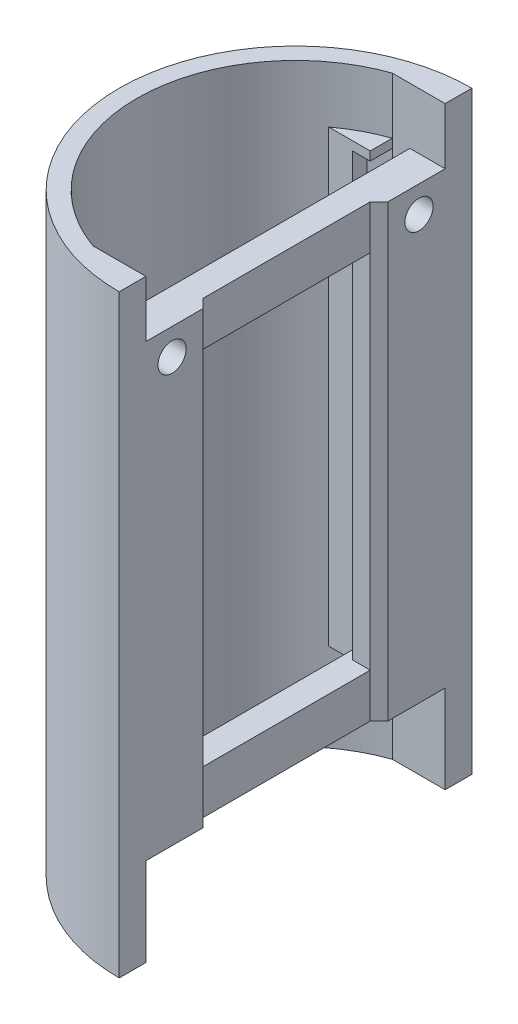
from build123d import *
from build123d.topology import SkipClean

# Parameters (mm, degrees)
EXTRUDE_1_DEPTH           = 70
SKETCH_3_R                = 1
CUT_EXTRUDE_2_DEPTH       = 4
CUT_EXTRUDE_START         = 70
SKETCH_5_W                = 4
SKETCH_5_H                = 33.941125496
CUT_EXTRUDE_4_DEPTH       = 9
EXTRUDE_2_DEPTH           = 70
SKETCH_7_W                = 4
SKETCH_7_H                = 33.941125496
CUT_EXTRUDE_5_DEPTH       = 10
EXTRUDE_START             = 61
SKETCH_8_W                = 6
SKETCH_8_H                = 2.5
EXTRUDE_3_DEPTH           = 1
EXTRUDE_4_DEPTH           = 70
SKETCH_11_W               = 6
SKETCH_11_H               = 2.5
EXTRUDE_5_DEPTH           = 9
CUT_EXTRUDE_START_2       = 16.970563
SKETCH_12_W               = 2
SKETCH_12_H               = 1
CUT_EXTRUDE_6_DEPTH       = 33.941125497
CUT_EXTRUDE_START_3       = 10
SKETCH_14_W               = 1
SKETCH_14_H               = 20.941125496
CUT_EXTRUDE_8_DEPTH       = 51
CUT_EXTRUDE_START_4       = -1
SKETCH_15_W               = 18.941125496
SKETCH_15_H               = 41
CUT_EXTRUDE_9_DEPTH       = 2
SKETCH_17_R               = 1.6
CUT_EXTRUDE_10_DEPTH      = 2.5
EXTRUDE_11_DEPTH          = 51
EXTRUDE_12_DEPTH          = 5
EXTRUDE_START_2           = 10
EXTRUDE_13_DEPTH          = 5
CUT_EXTRUDE_START_5       = 55
CUT_EXTRUDE_11_DEPTH      = 6
CUT_EXTRUDE_12_REACH      = 77.498
CUT_EXTRUDE_12_END_RADIUS = 18
SKETCH_24_W               = 2
SKETCH_24_H               = 6
CUT_EXTRUDE_13_DEPTH      = 10
CUT_EXTRUDE_START_6       = 61
CUT_EXTRUDE_18_DEPTH      = 9
EXTRUDE_START_3           = 60
EXTRUDE_16_DEPTH          = 1
EXTRUDE_START_4           = 70
EXTRUDE_17_DEPTH          = 2.4
CUT_EXTRUDE_START_7       = 67.4
CUT_EXTRUDE_19_DEPTH      = 5
SKETCH_33_W               = 2
SKETCH_33_H               = 33.941125496
CUT_EXTRUDE_20_DEPTH      = 61


# Read off the part's stored shape, not the designer's step: 切除-拉伸11
with BuildPart() as part:
    # 草图1 → 凸台-拉伸1 (new body)
    with BuildSketch(Plane(origin=(0, 0, 0), x_dir=(1, 0, 0), z_dir=(0, 1, 0))):
        with BuildLine():
            Line((0, 20), (0, -20))
            ThreePointArc((0, -20), (-20, 0), (0, 20))
        make_face()
        with BuildLine():
            Line((-4, -17.549928775), (-4, 17.549928775))
            ThreePointArc((-4, 17.549928775), (-18, 0), (-4, -17.549928775))
        make_face(mode=Mode.SUBTRACT)
    extrude(amount=EXTRUDE_1_DEPTH)

    # 草图3 → 切除-拉伸2 (cut)
    with BuildSketch(Plane(origin=(0, 0, 0), x_dir=(0, 0, -1), z_dir=(1, 0, 0))):
        with Locations(Location((-14, 58, 0), (0, 0, 180))):
            Circle(SKETCH_3_R)
        with Locations(Location((14, 58, 0), (0, 0, 180))):
            Circle(SKETCH_3_R)
    extrude(amount=-CUT_EXTRUDE_2_DEPTH, mode=Mode.SUBTRACT)

    # 草图5 → 切除-拉伸4 (cut)
    with BuildSketch(Plane(origin=(0, 0, 0), x_dir=(1, 0, 0), z_dir=(0, 1, 0)).offset(CUT_EXTRUDE_START)):
        with Locations((-2, 0)):
            Rectangle(SKETCH_5_W, SKETCH_5_H)
    extrude(amount=-CUT_EXTRUDE_4_DEPTH, mode=Mode.SUBTRACT)

    # 草图6 → 凸台-拉伸2 (add)
    with BuildSketch(Plane(origin=(0, 0, 0), x_dir=(1, 0, 0), z_dir=(0, 1, 0))):
        with BuildLine():
            Line((-4, 16.970562748), (-6, 16.970562748))
            ThreePointArc((-6, 16.970562748), (-3.043835617, 17.740774074), (0, 18))
            Line((0, 18), (0, 16.970562748))
            Line((0, 16.970562748), (-4, 16.970562748))
        make_face()
        with BuildLine():
            Line((-4, -16.970562748), (-6, -16.970562748))
            ThreePointArc((-6, -16.970562748), (-3.043835617, -17.740774074), (0, -18))
            Line((0, -18), (0, -16.970562748))
            Line((0, -16.970562748), (-4, -16.970562748))
        make_face()
    extrude(amount=EXTRUDE_2_DEPTH)

    # 草图7 → 切除-拉伸5 (cut)
    with BuildSketch(Plane(origin=(0, 0, 0), x_dir=(1, 0, 0), z_dir=(0, 1, 0))):
        with Locations((-2, 0)):
            Rectangle(SKETCH_7_W, SKETCH_7_H)
    extrude(amount=CUT_EXTRUDE_5_DEPTH, mode=Mode.SUBTRACT)

    # 草图8 → 凸台-拉伸3 (add)
    with BuildSketch(Plane(origin=(0, 0, 0), x_dir=(1, 0, 0), z_dir=(0, 1, 0)).offset(EXTRUDE_START)):
        with Locations((-3, 15.720562748)):
            Rectangle(SKETCH_8_W, SKETCH_8_H)
        with Locations((-3, -15.720562748)):
            Rectangle(SKETCH_8_W, SKETCH_8_H)
    extrude(amount=-EXTRUDE_3_DEPTH)

    # 草图10 → 凸台-拉伸4 (add)
    with BuildSketch(Plane(origin=(0, 0, 0), x_dir=(1, 0, 0), z_dir=(0, 1, 0))):
        with BuildLine():
            Line((-6, 16.970562748), (-6, 14.470562748))
            Line((-6, 14.470562748), (-10.705270372, 14.470562748))
            ThreePointArc((-10.705270372, 14.470562748), (-8.445650629, 15.895627872), (-6, 16.970562748))
        make_face()
        with BuildLine():
            Line((-6, -14.470562748), (-10.705270372, -14.470562748))
            ThreePointArc((-10.705270372, -14.470562748), (-8.445650629, -15.895627872), (-6, -16.970562748))
            Line((-6, -16.970562748), (-6, -14.470562748))
        make_face()
    extrude(amount=EXTRUDE_4_DEPTH)

    # 草图11 → 凸台-拉伸5 (add)
    with BuildSketch(Plane(origin=(0, 0, 0), x_dir=(1, 0, 0), z_dir=(0, 1, 0)).offset(EXTRUDE_START)):
        with Locations((-3, 15.720562748)):
            Rectangle(SKETCH_11_W, SKETCH_11_H)
        with Locations((-3, -15.720562748)):
            Rectangle(SKETCH_11_W, SKETCH_11_H)
    extrude(amount=EXTRUDE_5_DEPTH)

    # 草图12 → 切除-拉伸6 (cut)
    with SkipClean():  # the faces are left unmerged after this step: merging them gives an invalid solid
        with BuildSketch(Plane.XY.offset(CUT_EXTRUDE_START_2)):
            with Locations((-5, 60.5)):
                Rectangle(SKETCH_12_W, SKETCH_12_H)
        extrude(amount=-CUT_EXTRUDE_6_DEPTH, mode=Mode.SUBTRACT)

    # 草图14 → 切除-拉伸8 (cut)
    with SkipClean():  # the faces are left unmerged after this step: merging them gives an invalid solid
        with BuildSketch(Plane(origin=(0, 0, 0), x_dir=(1, 0, 0), z_dir=(0, 1, 0)).offset(CUT_EXTRUDE_START_3)):
            with Locations((-3.5, 0)):
                Rectangle(SKETCH_14_W, SKETCH_14_H)
            with Locations((-0.5, 0)):
                Rectangle(SKETCH_14_W, SKETCH_14_H)
        extrude(amount=CUT_EXTRUDE_8_DEPTH, mode=Mode.SUBTRACT)

    # 草图15 → 切除-拉伸9 (cut)
    with SkipClean():  # the faces are left unmerged after this step: merging them gives an invalid solid
        with BuildSketch(Plane(origin=(0, 0, 0), x_dir=(0, 0, -1), z_dir=(1, 0, 0)).offset(CUT_EXTRUDE_START_4)):
            with Locations((0, 35.5)):
                Rectangle(SKETCH_15_W, SKETCH_15_H)
        extrude(amount=-CUT_EXTRUDE_9_DEPTH, mode=Mode.SUBTRACT)

    # 草图17 → 切除-拉伸10 (cut)
    with SkipClean():  # the faces are left unmerged after this step: merging them gives an invalid solid
        with BuildSketch(Plane(origin=(0, 0, 0), x_dir=(0, 0, -1), z_dir=(1, 0, 0))):
            with Locations((-14, 58)):
                Circle(SKETCH_17_R)
            with Locations((14, 58)):
                Circle(SKETCH_17_R)
        extrude(amount=-CUT_EXTRUDE_10_DEPTH, mode=Mode.SUBTRACT)

    # 草图20 → 凸台-拉伸11 (add)
    with SkipClean():  # the faces are left unmerged after this step: merging them gives an invalid solid
        with BuildSketch(Plane(origin=(0, 0, 0), x_dir=(1, 0, 0), z_dir=(0, 1, 0)).offset(EXTRUDE_START)):
            Polygon((-1, 10.470562748), (0, 10.470562748), (-1, 9.470562748), align=None)
            Polygon((-4, 10.470562748), (-3, 10.470562748), (-3, 9.470562748), align=None)
            Polygon((-4, -10.470562748), (-3, -10.470562748), (-3, -9.470562748), align=None)
            Polygon((0, -10.470562748), (-1, -10.470562748), (-1, -9.470562748), align=None)
        extrude(amount=-EXTRUDE_11_DEPTH)

    # 草图21 → 凸台-拉伸12 (add)
    with SkipClean():  # the faces are left unmerged after this step: merging them gives an invalid solid
        with BuildSketch(Plane(origin=(0, 0, 0), x_dir=(1, 0, 0), z_dir=(0, 1, 0)).offset(EXTRUDE_START)):
            Polygon((-4, 10.470562748), (-4, -10.470562748), (-3, -9.470562748), (-3, 9.470562748), align=None)
        extrude(amount=-EXTRUDE_12_DEPTH)

    # 草图22 → 凸台-拉伸13 (add)
    with SkipClean():  # the faces are left unmerged after this step: merging them gives an invalid solid
        with BuildSketch(Plane(origin=(0, 0, 0), x_dir=(1, 0, 0), z_dir=(0, 1, 0)).offset(EXTRUDE_START_2)):
            Polygon((-4, 10.470562748), (-4, -10.470562748), (-3, -9.470562748), (-3, 9.470562748), align=None)
        extrude(amount=EXTRUDE_13_DEPTH)

    # 切除-拉伸11 outline → 切除-拉伸11 (cut)
    with SkipClean():  # the faces are left unmerged after this step: merging them gives an invalid solid
        with BuildSketch(Plane(origin=(0, 0, 0), x_dir=(1, 0, 0), z_dir=(0, 1, 0)).offset(CUT_EXTRUDE_START_5)):
            with BuildLine():
                ThreePointArc((-8, -16.124515497), (-7.012770422, -16.577727559), (-6, -16.970562748))
                Line((-6, -16.970562748), (-6, -14.470562748))
                Line((-6, -14.470562748), (-8, -14.470562748))
                Line((-8, -14.470562748), (-8, -16.124515497))
            make_face()
        extrude(amount=CUT_EXTRUDE_11_DEPTH, mode=Mode.SUBTRACT)

    # 切除-拉伸12: up to this cylinder (the profile starts inside it)
    with SkipClean():  # the faces are left unmerged after this step: merging them gives an invalid solid
        cut_extrude_12_end = Plane(origin=(0, 58, 0), z_dir=(0, -1, 0)) * Cylinder(CUT_EXTRUDE_12_END_RADIUS, 191.996, mode=Mode.PRIVATE)
        # 草图24 → 切除-拉伸12 (cut, up to the surface)
        with BuildSketch(Plane.XY, mode=Mode.PRIVATE) as cut_extrude_12_sk1:
            with Locations((-7, 58)):
                Rectangle(SKETCH_24_W, SKETCH_24_H)
        cut_extrude_12_tool1 = extrude(cut_extrude_12_sk1.sketch, amount=-CUT_EXTRUDE_12_REACH, mode=Mode.PRIVATE) & cut_extrude_12_end
        add(cut_extrude_12_tool1.solids().sort_by_distance((-7, 58, 0))[0], mode=Mode.SUBTRACT)

    # 草图25 → 切除-拉伸13 (cut)
    with SkipClean():  # the faces are left unmerged after this step: merging them gives an invalid solid
        with BuildSketch(Plane(origin=(0, 0, 0), x_dir=(1, 0, 0), z_dir=(0, 1, 0))):
            with BuildLine():
                Line((-6, -16.970562748), (-6, -14.470562748))
                Line((-6, -14.470562748), (-10.705270372, -14.470562748))
                ThreePointArc((-10.705270372, -14.470562748), (-8.445650629, -15.895627872), (-6, -16.970562748))
            make_face()
            with BuildLine():
                Line((-10.705270372, 14.470562748), (-6, 14.470562748))
                Line((-6, 14.470562748), (-6, 16.970562748))
                ThreePointArc((-6, 16.970562748), (-8.445650629, 15.895627872), (-10.705270372, 14.470562748))
            make_face()
        extrude(amount=CUT_EXTRUDE_13_DEPTH, mode=Mode.SUBTRACT)

    # 草图29 → 切除-拉伸18 (cut)
    with SkipClean():  # the faces are left unmerged after this step: merging them gives an invalid solid
        with BuildSketch(Plane(origin=(0, 0, 0), x_dir=(1, 0, 0), z_dir=(0, 1, 0)).offset(CUT_EXTRUDE_START_6)):
            with BuildLine():
                Line((0, -16.970562748), (0, -14.470562748))
                Line((0, -14.470562748), (-10.705270372, -14.470562748))
                ThreePointArc((-10.705270372, -14.470562748), (-8.445650629, -15.895627872), (-6, -16.970562748))
                Line((-6, -16.970562748), (0, -16.970562748))
            make_face()
            with BuildLine():
                Line((-6, 16.970562748), (0, 16.970562748))
                Line((0, 16.970562748), (0, 14.470562748))
                Line((0, 14.470562748), (-10.705270372, 14.470562748))
                ThreePointArc((-10.705270372, 14.470562748), (-8.445650629, 15.895627872), (-6, 16.970562748))
            make_face()
        extrude(amount=CUT_EXTRUDE_18_DEPTH, mode=Mode.SUBTRACT)

    # 草图30 → 凸台-拉伸16 (add)
    with BuildSketch(Plane(origin=(0, 0, 0), x_dir=(1, 0, 0), z_dir=(0, 1, 0)).offset(EXTRUDE_START_3)):
        with BuildLine():
            Line((-8, 16.124515497), (-8, 14.470562748))
            Line((-8, 14.470562748), (-4, 14.470562748))
            Line((-4, 14.470562748), (-4, 16.970562748))
            Line((-4, 16.970562748), (-6, 16.970562748))
            ThreePointArc((-6, 16.970562748), (-7.012770422, 16.577727559), (-8, 16.124515497))
        make_face()
        with BuildLine():
            Line((-8, -16.124515497), (-8, -14.470562748))
            Line((-8, -14.470562748), (-4, -14.470562748))
            Line((-4, -14.470562748), (-4, -16.970562748))
            Line((-4, -16.970562748), (-6, -16.970562748))
            ThreePointArc((-6, -16.970562748), (-7.012770422, -16.577727559), (-8, -16.124515497))
        make_face()
    extrude(amount=EXTRUDE_16_DEPTH)

    # 草图31 → 凸台-拉伸17 (add)
    with BuildSketch(Plane(origin=(0, 0, 0), x_dir=(1, 0, 0), z_dir=(0, 1, 0)).offset(EXTRUDE_START_4)):
        with BuildLine():
            Line((0, -20), (0, -16.970562748))
            Line((0, -16.970562748), (-6, -16.970562748))
            ThreePointArc((-6, -16.970562748), (-18, 0), (-6, 16.970562748))
            Line((-6, 16.970562748), (0, 16.970562748))
            Line((0, 16.970562748), (0, 20))
            ThreePointArc((0, 20), (-20, 0), (0, -20))
        make_face()
    extrude(amount=EXTRUDE_17_DEPTH)

    # 草图32 → 切除-拉伸19 (cut)
    with BuildSketch(Plane(origin=(0, 0, 0), x_dir=(1, 0, 0), z_dir=(0, 1, 0)).offset(CUT_EXTRUDE_START_7)):
        with BuildLine():
            Line((0, 16.970562748), (0, 20))
            ThreePointArc((0, 20), (-20, 0), (0, -20))
            Line((0, -20), (0, -16.970562748))
            Line((0, -16.970562748), (-6, -16.970562748))
            ThreePointArc((-6, -16.970562748), (-18, 0), (-6, 16.970562748))
            Line((-6, 16.970562748), (0, 16.970562748))
        make_face()
    extrude(amount=CUT_EXTRUDE_19_DEPTH, mode=Mode.SUBTRACT)

    # 草图33 → 切除-拉伸20 (cut)
    with BuildSketch(Plane(origin=(0, 0, 0), x_dir=(1, 0, 0), z_dir=(0, 1, 0))):
        with Locations((-5, 0)):
            Rectangle(SKETCH_33_W, SKETCH_33_H)
    extrude(amount=CUT_EXTRUDE_20_DEPTH, mode=Mode.SUBTRACT)


solid = part.part
